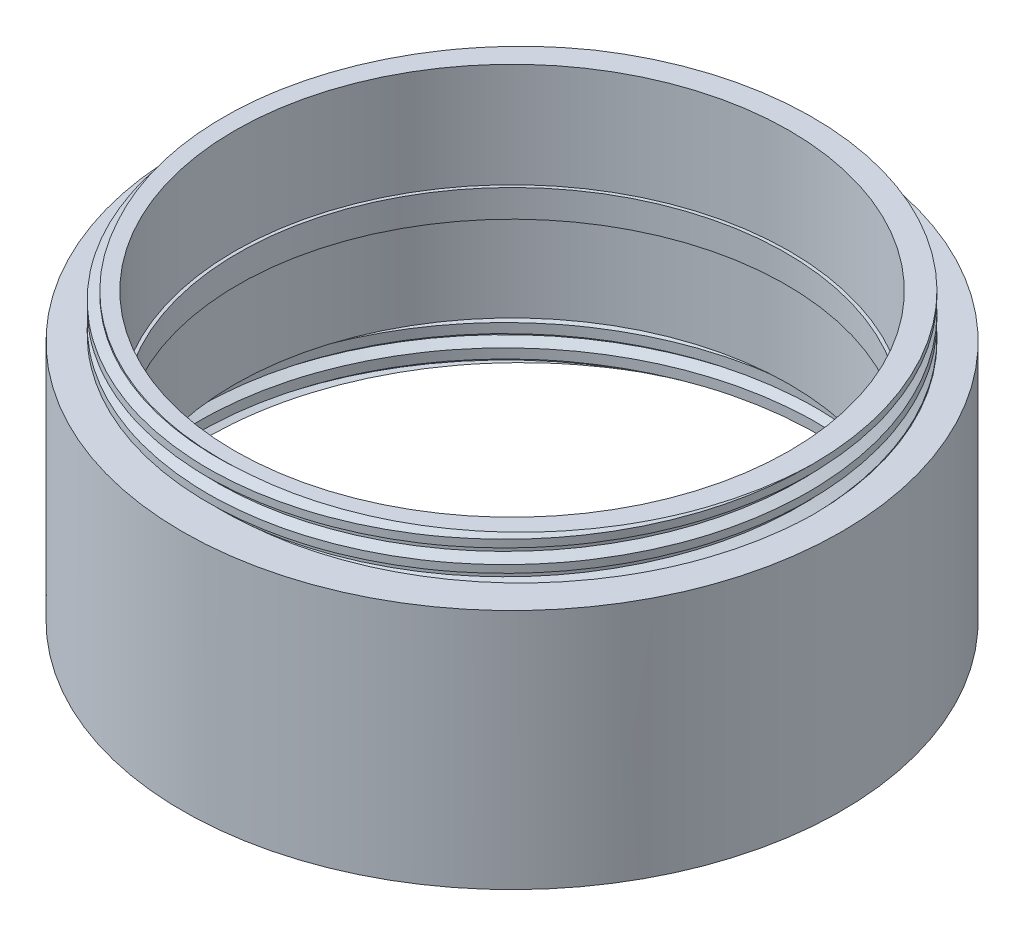
from build123d import *
from build123d.topology import SkipClean

# Parameters (mm, degrees)
SKETCH1_R           = 30
BOSS_EXTRUDE1_DEPTH = 15
SKETCH2_R           = 30
SKETCH2_R_2         = 25.25
SKETCH2_R_3         = 12.125
BOSS_EXTRUDE2_DEPTH = 15
SKETCH4_W           = 9
SKETCH4_H           = 5
CUT_EXTRUDE1_DEPTH  = 46
CUT_EXTRUDE2_START  = -5
SKETCH11_R          = 30
SKETCH11_R_2        = 27.35
CUT_EXTRUDE2_DEPTH  = 5
THREAD3_PITCH       = 2
SKETCH14_R          = 30
CUT_EXTRUDE3_DEPTH  = 2
SKETCH16_R          = 30
CUT_EXTRUDE5_DEPTH  = 1
CUT_EXTRUDE6_START  = -1
SKETCH17_R          = 30
CUT_EXTRUDE6_DEPTH  = 1
BOSS_EXTRUDE5_START = -3
SKETCH18_R          = 30
SKETCH18_W          = 9
SKETCH18_H          = 5
BOSS_EXTRUDE5_DEPTH = 3
SKETCH19_R          = 28.1
SKETCH19_R_2        = 25.25
CUT_EXTRUDE7_DEPTH  = 6
THREAD4_PITCH       = 2
SKETCH25_R          = 25.25
CUT_EXTRUDE8_DEPTH  = 50.759421391
BOSS_EXTRUDE6_START = 2.5
SKETCH26_R          = 25.25
SKETCH26_R_2        = 24.95
BOSS_EXTRUDE6_DEPTH = 2.5


with BuildPart() as part:
    # Sketch1 → Boss-Extrude1 (new body)
    with BuildSketch(Plane(origin=(0, 0, 0), x_dir=(1, 0, 0), z_dir=(0, 1, 0))):
        with Locations(Location((0, 0, 0), (0, 0, 270))):
            Circle(SKETCH1_R)
    extrude(amount=BOSS_EXTRUDE1_DEPTH)

    # Sketch2 → Boss-Extrude2 (add)
    # profile 1 of 2: a face of its own
    with BuildSketch(Plane(origin=(0, 15, 0), x_dir=(1, 0, 0), z_dir=(0, 1, 0))):
        with Locations(Location((0, 0, 0), (0, 0, 270))):
            Circle(SKETCH2_R)
        with Locations(Location((0, 0, 0), (0, 0, 270))):
            Circle(SKETCH2_R_2, mode=Mode.SUBTRACT)
    # profile 2 of 2: a face of its own
    with BuildSketch(Plane(origin=(0, 15, 0), x_dir=(1, 0, 0), z_dir=(0, 1, 0))):
        with Locations(Location((0, 0, 0), (0, 0, 270))):
            Circle(SKETCH2_R_3)
    extrude(amount=BOSS_EXTRUDE2_DEPTH)

    # Sketch4 → Cut-Extrude1 (cut, through all)
    with BuildSketch(Plane(origin=(0, 15, 0), x_dir=(1, 0, 0), z_dir=(0, 1, 0))):
        with Locations((16.625, 0)):
            Rectangle(SKETCH4_W, SKETCH4_H)
    extrude(amount=-CUT_EXTRUDE1_DEPTH, mode=Mode.SUBTRACT)

    # Sketch11 → Cut-Extrude2 (cut)
    with BuildSketch(Plane(origin=(0, 30, 0), x_dir=(1, 0, 0), z_dir=(0, 1, 0)).offset(CUT_EXTRUDE2_START)):
        with Locations(Location((0, 0, 0), (0, 0, 270))):
            Circle(SKETCH11_R)
        with Locations(Location((0, 0, 0), (0, 0, 270))):
            Circle(SKETCH11_R_2, mode=Mode.SUBTRACT)
    extrude(amount=CUT_EXTRUDE2_DEPTH, mode=Mode.SUBTRACT)

    # Thread3: arcs per turn and ends read off the stored shape
    # Thread3: the profile of Thread Profile3 profile screwed along a right-hand helix through 3.5 turns, 10 arcs to a turn; built about Z, then put on its axis
    thread3_z = Axis((0, 0, 0), (0, 0, 1))
    thread3_corners = [(-27.3503, 0, -7.000173205), (-27.3503, 0, -5.687326799), (-26.538101187, 0, -6.156250002), (-26.538101187, 0, -6.531250002)]
    with BuildLine(mode=Mode.PRIVATE) as thread3_profile:
        Line(thread3_corners[0], thread3_corners[1])
        Line(thread3_corners[1], thread3_corners[2])
        Line(thread3_corners[2], thread3_corners[3])
        Line(thread3_corners[3], thread3_corners[0])
    thread3_cap = Face(thread3_profile.wire())
    thread3_turn_angles = [0, 18, 36, 54, 72, 90, 108, 126, 144, 162, 180, 198, 216, 234, 252, 270, 288, 306, 324, 342, 360]
    thread3_turn_weights = [1, 0.9510565162951535, 1, 0.9510565162951535, 1, 0.9510565162951535, 1, 0.9510565162951535, 1, 0.9510565162951535, 1, 0.9510565162951535, 1, 0.9510565162951535, 1, 0.9510565162951535, 1, 0.9510565162951535, 1, 0.9510565162951535, 1]
    thread3_turn_rails = [Edge.make_bspline([Vector(p[0], p[1], 0).rotate(thread3_z, thread3_turn_angles[k]) / thread3_turn_weights[k] + Vector(0, 0, p[2] + THREAD3_PITCH * thread3_turn_angles[k] / 360) for k in range(21)], [0, 0, 0, 1, 1, 2, 2, 3, 3, 4, 4, 5, 5, 6, 6, 7, 7, 8, 8, 9, 9, 10, 10, 10], 2, thread3_turn_weights) for p in thread3_corners]
    thread3_turn_sides = [Face.make_surface_from_curves(thread3_turn_rails[p[0]], thread3_turn_rails[p[1]]) for p in [(0, 1), (1, 2), (2, 3), (3, 0)]]
    thread3_last_angles = [1080, 1098, 1116, 1134, 1152, 1170, 1188, 1206, 1224, 1242, 1260]
    thread3_last_weights = [1, 0.9510565162951535, 1, 0.9510565162951535, 1, 0.9510565162951535, 1, 0.9510565162951535, 1, 0.9510565162951535, 1]
    thread3_last_rails = [Edge.make_bspline([Vector(p[0], p[1], 0).rotate(thread3_z, thread3_last_angles[k]) / thread3_last_weights[k] + Vector(0, 0, p[2] + THREAD3_PITCH * thread3_last_angles[k] / 360) for k in range(11)], [0, 0, 0, 1, 1, 2, 2, 3, 3, 4, 4, 5, 5, 5], 2, thread3_last_weights) for p in thread3_corners]
    thread3_last_sides = [Face.make_surface_from_curves(thread3_last_rails[p[0]], thread3_last_rails[p[1]]) for p in [(0, 1), (1, 2), (2, 3), (3, 0)]]
    thread3 = Plane(origin=(0, 30, 0), x_dir=(-1, 0, 0), z_dir=(0, 1, 0)) * Solid(Shell([*[p.moved(Location((0, 0, THREAD3_PITCH * i))) for i in range(3) for p in thread3_turn_sides], *thread3_last_sides, thread3_cap, thread3_cap.rotate(thread3_z, 1260).moved(Location((0, 0, THREAD3_PITCH * 1260 / 360)))]))
    add(thread3, mode=Mode.SUBTRACT)

    # Sketch14 → Cut-Extrude3 (cut)
    with BuildSketch(Plane.XZ):
        with Locations(Location((0, 0, 0), (0, 0, 270))):
            Circle(SKETCH14_R)
    extrude(amount=-CUT_EXTRUDE3_DEPTH, mode=Mode.SUBTRACT)

    # Sketch16 → Cut-Extrude5 (cut)
    with BuildSketch(Plane.XZ.offset(-2)):
        with Locations(Location((0, 0, 0), (0, 0, 270))):
            Circle(SKETCH16_R)
    extrude(amount=-CUT_EXTRUDE5_DEPTH, mode=Mode.SUBTRACT)

    # Sketch17 → Cut-Extrude6 (cut)
    with BuildSketch(Plane(origin=(0, 30, 0), x_dir=(1, 0, 0), z_dir=(0, 1, 0)).offset(CUT_EXTRUDE6_START)):
        with Locations(Location((0, 0, 0), (0, 0, 90))):
            Circle(SKETCH17_R)
    extrude(amount=CUT_EXTRUDE6_DEPTH, mode=Mode.SUBTRACT)

    # Sketch18 → Boss-Extrude5 (add)
    with BuildSketch(Plane(origin=(0, 25, 0), x_dir=(1, 0, 0), z_dir=(0, 1, 0)).offset(BOSS_EXTRUDE5_START)):
        with Locations(Location((0, 0, 0), (0, 0, 90))):
            Circle(SKETCH18_R)
        with Locations((16.625, 0)):
            Rectangle(SKETCH18_W, SKETCH18_H, mode=Mode.SUBTRACT)
    extrude(amount=BOSS_EXTRUDE5_DEPTH)

    # Sketch19 → Cut-Extrude7 (cut)
    with BuildSketch(Plane.XZ.offset(-3)):
        with Locations(Location((0, 0, 0), (0, 0, 270))):
            Circle(SKETCH19_R)
        with Locations(Location((0, 0, 0), (0, 0, 90))):
            Circle(SKETCH19_R_2, mode=Mode.SUBTRACT)
    extrude(amount=-CUT_EXTRUDE7_DEPTH, mode=Mode.SUBTRACT)

    # Thread4: arcs per turn and ends read off the stored shape
    # Thread4: the profile of Thread Profile4 profile screwed along a right-hand helix through 3 turns, 10 arcs to a turn; built about Z, then put on its axis
    thread4_z = Axis((0, 0, 0), (0, 0, 1))
    thread4_corners = [(28.0997, 0, -6.000173205), (28.911898813, 0, -5.531250002), (28.911898813, 0, -5.343750002), (28.0997, 0, -4.874826799)]
    with BuildLine(mode=Mode.PRIVATE) as thread4_profile:
        Line(thread4_corners[0], thread4_corners[1])
        Line(thread4_corners[1], thread4_corners[2])
        Line(thread4_corners[2], thread4_corners[3])
        Line(thread4_corners[3], thread4_corners[0])
    thread4_cap = Face(thread4_profile.wire())
    thread4_turn_angles = [0, 18, 36, 54, 72, 90, 108, 126, 144, 162, 180, 198, 216, 234, 252, 270, 288, 306, 324, 342, 360]
    thread4_turn_weights = [1, 0.9510565162951535, 1, 0.9510565162951535, 1, 0.9510565162951535, 1, 0.9510565162951535, 1, 0.9510565162951535, 1, 0.9510565162951535, 1, 0.9510565162951535, 1, 0.9510565162951535, 1, 0.9510565162951535, 1, 0.9510565162951535, 1]
    thread4_turn_rails = [Edge.make_bspline([Vector(p[0], p[1], 0).rotate(thread4_z, thread4_turn_angles[k]) / thread4_turn_weights[k] + Vector(0, 0, p[2] + THREAD4_PITCH * thread4_turn_angles[k] / 360) for k in range(21)], [0, 0, 0, 1, 1, 2, 2, 3, 3, 4, 4, 5, 5, 6, 6, 7, 7, 8, 8, 9, 9, 10, 10, 10], 2, thread4_turn_weights) for p in thread4_corners]
    thread4_turn_sides = [Face.make_surface_from_curves(thread4_turn_rails[p[0]], thread4_turn_rails[p[1]]) for p in [(0, 1), (1, 2), (2, 3), (3, 0)]]
    thread4 = Plane(origin=(0, 3, 0), x_dir=(1, 0, 0), z_dir=(0, -1, 0)) * Solid(Shell([*[p.moved(Location((0, 0, THREAD4_PITCH * i))) for i in range(3) for p in thread4_turn_sides], thread4_cap, thread4_cap.rotate(thread4_z, 1080).moved(Location((0, 0, THREAD4_PITCH * 1080 / 360)))]))
    add(thread4, mode=Mode.SUBTRACT)

    # Sketch25 → Cut-Extrude8 (cut, through all)
    with SkipClean():  # the faces are left unmerged after this step: merging them gives an invalid solid
        with BuildSketch(Plane.XZ.offset(-3)):
            with Locations(Location((0, 0, 0), (0, 0, 270))):
                Circle(SKETCH25_R)
        extrude(amount=-CUT_EXTRUDE8_DEPTH, mode=Mode.SUBTRACT)

    # Sketch26 → Boss-Extrude6 (add)
    with BuildSketch(Plane(origin=(0, 19.5, 0), x_dir=(-1, 0, 0), z_dir=(0, -1, 0)).offset(BOSS_EXTRUDE6_START)):
        with Locations(Location((0, 0, 0), (0, 0, 180))):
            Circle(SKETCH26_R)
        with Locations(Location((0, 0, 0), (0, 0, 180))):
            Circle(SKETCH26_R_2, mode=Mode.SUBTRACT)
    extrude(amount=-BOSS_EXTRUDE6_DEPTH)


solid = part.part
